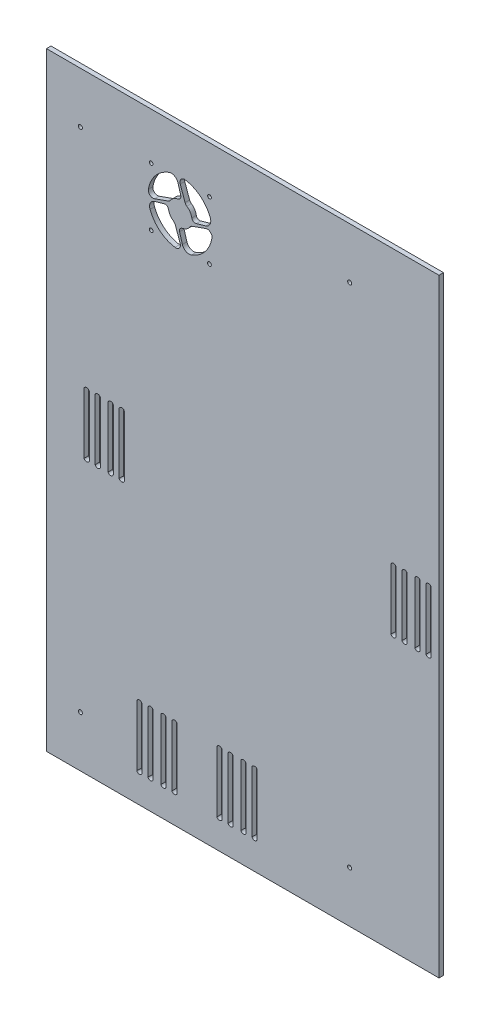
from build123d import *

# Parameters (mm, degrees)
SKETCH_1_W      = 347
SKETCH_1_H      = 538
SKETCH_1_R      = 1.801851852
SKETCH_1_R_2    = 1.647407407
EXTRUDE_1_DEPTH = 4


with BuildPart() as part:
    # Эскиз1 → Бобышка-Вытянуть1 (new body)
    with BuildSketch(Plane.XY):
        with Locations((881.38538727, 735.527783664)):
            Rectangle(SKETCH_1_W, SKETCH_1_H)
        with Locations((737.88538727, 959.527783664)):
            Circle(SKETCH_1_R, mode=Mode.SUBTRACT)
        with Locations((975.88538727, 511.527783664)):
            Circle(SKETCH_1_R, mode=Mode.SUBTRACT)
        with Locations((737.88538727, 511.527783664)):
            Circle(SKETCH_1_R, mode=Mode.SUBTRACT)
        with Locations((975.88538727, 959.527783664)):
            Circle(SKETCH_1_R, mode=Mode.SUBTRACT)
        with Locations((851.968979662, 911.695836168)):
            Circle(SKETCH_1_R_2, mode=Mode.SUBTRACT)
        with Locations((800.48749818, 911.695836168)):
            Circle(SKETCH_1_R_2, mode=Mode.SUBTRACT)
        with Locations((851.968979662, 963.17731765)):
            Circle(SKETCH_1_R_2, mode=Mode.SUBTRACT)
        with Locations((800.48749818, 963.17731765)):
            Circle(SKETCH_1_R_2, mode=Mode.SUBTRACT)
        with BuildLine():
            Line((1043.387252951, 762.470545202), (1043.387252951, 708.585022126))
            ThreePointArc((1043.387252951, 708.585022126), (1045.703919618, 707.079482803), (1048.020586284, 708.585022126))
            Line((1048.020586284, 708.585022126), (1048.020586284, 762.470545202))
            ThreePointArc((1048.020586284, 762.470545202), (1045.703919618, 763.976084525), (1043.387252951, 762.470545202))
        make_face(mode=Mode.SUBTRACT)
        with BuildLine():
            Line((1033.580030729, 762.470545202), (1033.580030729, 708.585022126))
            ThreePointArc((1033.580030729, 708.585022126), (1035.896697396, 707.079482803), (1038.213364062, 708.585022126))
            Line((1038.213364062, 708.585022126), (1038.213364062, 762.470545202))
            ThreePointArc((1038.213364062, 762.470545202), (1035.896697396, 763.976084525), (1033.580030729, 762.470545202))
        make_face(mode=Mode.SUBTRACT)
        with BuildLine():
            Line((1022.160033073, 762.350251776), (1022.160033073, 708.4647287))
            ThreePointArc((1022.160033073, 708.4647287), (1024.47669974, 706.959189377), (1026.793366406, 708.4647287))
            Line((1026.793366406, 708.4647287), (1026.793366406, 762.350251776))
            ThreePointArc((1026.793366406, 762.350251776), (1024.47669974, 763.855791099), (1022.160033073, 762.350251776))
        make_face(mode=Mode.SUBTRACT)
        with BuildLine():
            Line((1012.352810851, 762.350251776), (1012.352810851, 708.4647287))
            ThreePointArc((1012.352810851, 708.4647287), (1014.669477517, 706.959189377), (1016.986144184, 708.4647287))
            Line((1016.986144184, 708.4647287), (1016.986144184, 762.350251776))
            ThreePointArc((1016.986144184, 762.350251776), (1014.669477517, 763.855791099), (1012.352810851, 762.350251776))
        make_face(mode=Mode.SUBTRACT)
        with BuildLine():
            Line((889.535088546, 545.689203858), (889.535088546, 491.803680782))
            ThreePointArc((889.535088546, 491.803680782), (891.851755212, 490.298141459), (894.168421879, 491.803680782))
            Line((894.168421879, 491.803680782), (894.168421879, 545.689203858))
            ThreePointArc((894.168421879, 545.689203858), (891.851755212, 547.194743181), (889.535088546, 545.689203858))
        make_face(mode=Mode.SUBTRACT)
        with BuildLine():
            Line((879.727866323, 545.689203858), (879.727866323, 491.803680782))
            ThreePointArc((879.727866323, 491.803680782), (882.04453299, 490.298141459), (884.361199657, 491.803680782))
            Line((884.361199657, 491.803680782), (884.361199657, 545.689203858))
            ThreePointArc((884.361199657, 545.689203858), (882.04453299, 547.194743181), (879.727866323, 545.689203858))
        make_face(mode=Mode.SUBTRACT)
        with BuildLine():
            Line((868.307868668, 545.568910432), (868.307868668, 491.683387356))
            ThreePointArc((868.307868668, 491.683387356), (870.624535334, 490.177848033), (872.941202001, 491.683387356))
            Line((872.941202001, 491.683387356), (872.941202001, 545.568910432))
            ThreePointArc((872.941202001, 545.568910432), (870.624535334, 547.074449755), (868.307868668, 545.568910432))
        make_face(mode=Mode.SUBTRACT)
        with BuildLine():
            Line((858.500646445, 545.568910432), (858.500646445, 491.683387356))
            ThreePointArc((858.500646445, 491.683387356), (860.817313112, 490.177848033), (863.133979779, 491.683387356))
            Line((863.133979779, 491.683387356), (863.133979779, 545.568910432))
            ThreePointArc((863.133979779, 545.568910432), (860.817313112, 547.074449755), (858.500646445, 545.568910432))
        make_face(mode=Mode.SUBTRACT)
        with BuildLine():
            Line((818.749581362, 545.568910432), (818.749581362, 491.683387356))
            ThreePointArc((818.749581362, 491.683387356), (821.066248029, 490.177848033), (823.382914696, 491.683387356))
            Line((823.382914696, 491.683387356), (823.382914696, 545.568910432))
            ThreePointArc((823.382914696, 545.568910432), (821.066248029, 547.074449755), (818.749581362, 545.568910432))
        make_face(mode=Mode.SUBTRACT)
        with BuildLine():
            Line((808.94235914, 545.568910432), (808.94235914, 491.683387356))
            ThreePointArc((808.94235914, 491.683387356), (811.259025807, 490.177848033), (813.575692474, 491.683387356))
            Line((813.575692474, 491.683387356), (813.575692474, 545.568910432))
            ThreePointArc((813.575692474, 545.568910432), (811.259025807, 547.074449755), (808.94235914, 545.568910432))
        make_face(mode=Mode.SUBTRACT)
        with BuildLine():
            Line((797.522361484, 545.448617007), (797.522361484, 491.563093931))
            ThreePointArc((797.522361484, 491.563093931), (799.839028151, 490.057554608), (802.155694818, 491.563093931))
            Line((802.155694818, 491.563093931), (802.155694818, 545.448617007))
            ThreePointArc((802.155694818, 545.448617007), (799.839028151, 546.95415633), (797.522361484, 545.448617007))
        make_face(mode=Mode.SUBTRACT)
        with BuildLine():
            Line((787.715139262, 545.448617007), (787.715139262, 491.563093931))
            ThreePointArc((787.715139262, 491.563093931), (790.031805929, 490.057554608), (792.348472595, 491.563093931))
            Line((792.348472595, 491.563093931), (792.348472595, 545.448617007))
            ThreePointArc((792.348472595, 545.448617007), (790.031805929, 546.95415633), (787.715139262, 545.448617007))
        make_face(mode=Mode.SUBTRACT)
        with BuildLine():
            Line((825.57328141, 923.101113539), (827.999962366, 914.701597382))
            ThreePointArc((827.999962366, 914.701597382), (831.165781333, 910.893930695), (836.110813814, 910.634336602))
            ThreePointArc((836.110813814, 910.634336602), (848.101122839, 919.233449097), (854.173649394, 932.681001569))
            ThreePointArc((854.173649394, 932.681001569), (852.746138702, 936.508460143), (848.72424222, 937.223704578))
            Line((848.72424222, 937.223704578), (836.736095109, 932.943780425))
            ThreePointArc((836.736095109, 932.943780425), (835.604104829, 932.325125011), (834.719029385, 931.386627288))
            ThreePointArc((834.719029385, 931.386627288), (831.787869584, 928.517679596), (827.979119882, 926.995843744))
            ThreePointArc((827.979119882, 926.995843744), (825.912867179, 925.581773828), (825.57328141, 923.101113539))
        make_face(mode=Mode.SUBTRACT)
        with BuildLine():
            Line((811.89277538, 937.787953162), (803.493259557, 935.361272303))
            ThreePointArc((803.493259557, 935.361272303), (799.685592871, 932.195453335), (799.425998777, 927.250420855))
            ThreePointArc((799.425998777, 927.250420855), (808.025111175, 915.260111909), (821.472663495, 909.187585316))
            ThreePointArc((821.472663495, 909.187585316), (825.300122122, 910.615096022), (826.015366511, 914.636992567))
            Line((826.015366511, 914.636992567), (821.735442451, 926.625138597))
            ThreePointArc((821.735442451, 926.625138597), (821.116787035, 927.757128834), (820.178289332, 928.642204245))
            ThreePointArc((820.178289332, 928.642204245), (817.309341421, 931.573364355), (815.787505625, 935.38211448))
            ThreePointArc((815.787505625, 935.38211448), (814.37343576, 937.448367338), (811.89277538, 937.787953162))
        make_face(mode=Mode.SUBTRACT)
        with BuildLine():
            Line((826.591163301, 951.452479369), (824.1644823, 959.851995685))
            ThreePointArc((824.1644823, 959.851995685), (820.998663448, 963.659662313), (816.053631094, 963.919256556))
            ThreePointArc((816.053631094, 963.919256556), (804.06332133, 955.320144102), (797.990794398, 941.872591169))
            ThreePointArc((797.990794398, 941.872591169), (799.41830509, 938.045132595), (803.440201571, 937.329888159))
            Line((803.440201571, 937.329888159), (815.428348682, 941.609812313))
            ThreePointArc((815.428348682, 941.609812313), (816.560338962, 942.228467727), (817.445414406, 943.166965449))
            ThreePointArc((817.445414406, 943.166965449), (820.37657451, 946.035913339), (824.185324619, 947.557749124))
            ThreePointArc((824.185324619, 947.557749124), (826.251577477, 948.971818989), (826.591163301, 951.452479369))
        make_face(mode=Mode.SUBTRACT)
        with BuildLine():
            Line((840.260120293, 936.781619044), (848.659637373, 939.208300598))
            ThreePointArc((848.659637373, 939.208300598), (852.467303917, 942.374119649), (852.726897901, 947.319152079))
            ThreePointArc((852.726897901, 947.319152079), (844.127785539, 959.309460691), (830.680233481, 965.381987156))
            ThreePointArc((830.680233481, 965.381987156), (826.852774981, 963.954476627), (826.1375303, 959.932580317))
            Line((826.1375303, 959.932580317), (830.417453284, 947.944433305))
            ThreePointArc((830.417453284, 947.944433305), (831.036108691, 946.81244286), (831.974606488, 945.927367289))
            ThreePointArc((831.974606488, 945.927367289), (834.84355418, 942.996207382), (836.365389963, 939.187457573))
            ThreePointArc((836.365389963, 939.187457573), (837.779459906, 937.121204775), (840.260120293, 936.781619044))
        make_face(mode=Mode.SUBTRACT)
        with BuildLine():
            Line((772.111790669, 761.440915572), (772.111790669, 707.555392496))
            ThreePointArc((772.111790669, 707.555392496), (774.428457336, 706.049853173), (776.745124003, 707.555392496))
            Line((776.745124003, 707.555392496), (776.745124003, 761.440915572))
            ThreePointArc((776.745124003, 761.440915572), (774.428457336, 762.946454895), (772.111790669, 761.440915572))
        make_face(mode=Mode.SUBTRACT)
        with BuildLine():
            Line((762.304568447, 761.440915572), (762.304568447, 707.555392496))
            ThreePointArc((762.304568447, 707.555392496), (764.621235114, 706.049853173), (766.93790178, 707.555392496))
            Line((766.93790178, 707.555392496), (766.93790178, 761.440915572))
            ThreePointArc((766.93790178, 761.440915572), (764.621235114, 762.946454895), (762.304568447, 761.440915572))
        make_face(mode=Mode.SUBTRACT)
        with BuildLine():
            Line((750.884570791, 761.320622146), (750.884570791, 707.43509907))
            ThreePointArc((750.884570791, 707.43509907), (753.201237458, 705.929559747), (755.517904124, 707.43509907))
            Line((755.517904124, 707.43509907), (755.517904124, 761.320622146))
            ThreePointArc((755.517904124, 761.320622146), (753.201237458, 762.826161469), (750.884570791, 761.320622146))
        make_face(mode=Mode.SUBTRACT)
        with BuildLine():
            Line((741.077348569, 761.320622146), (741.077348569, 707.43509907))
            ThreePointArc((741.077348569, 707.43509907), (743.394015236, 705.929559747), (745.710681902, 707.43509907))
            Line((745.710681902, 707.43509907), (745.710681902, 761.320622146))
            ThreePointArc((745.710681902, 761.320622146), (743.394015236, 762.826161469), (741.077348569, 761.320622146))
        make_face(mode=Mode.SUBTRACT)
    extrude(amount=EXTRUDE_1_DEPTH)


solid = part.part
